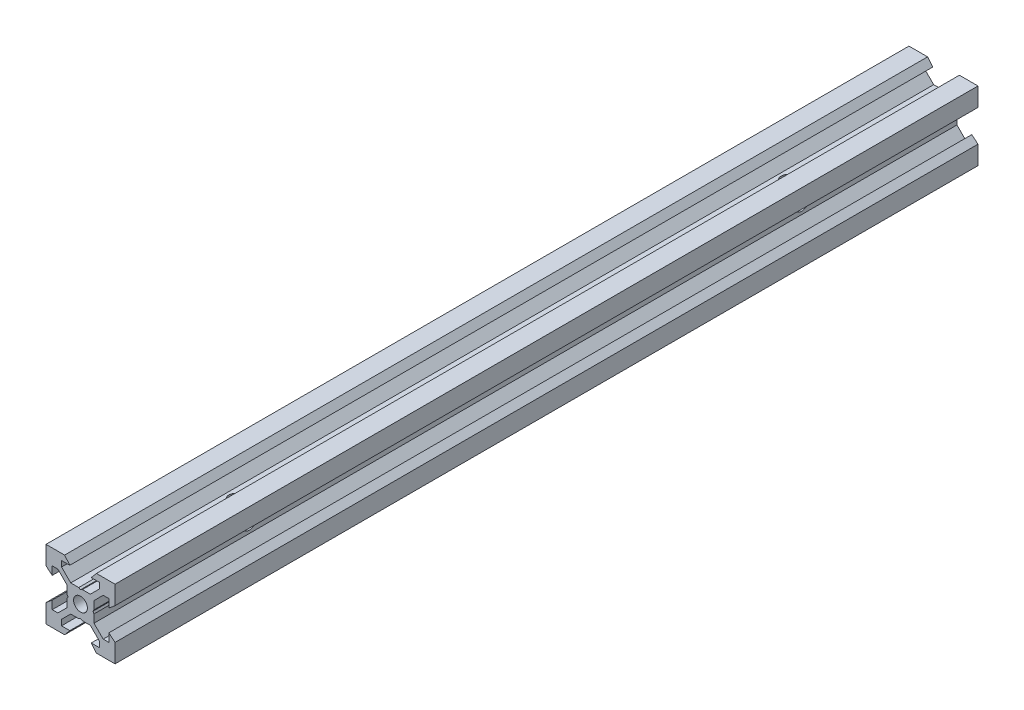
from build123d import *

# Parameters (mm, degrees)
SKETCH1_R               = 2
BOSS_EXTRUDE1_DEPTH     = 250
CUT_EXTRUDE1_DEPTH      = 251.585733832
CUT_EXTRUDE1_DEPTH_BACK = 251.585733832
SKETCH2_R               = 2
CUT_EXTRUDE2_DEPTH      = 251.585733832
CUT_EXTRUDE2_DEPTH_BACK = 251.585733832
SKETCH3_R               = 2


with BuildPart() as part:
    # Sketch1 → Boss-Extrude1 (new body)
    with BuildSketch(Plane.XY):
        Polygon((10, 4.610379336), (10, 10), (4.610379336, 10), (3.1, 8.2), (5.5, 8.2), (5.5, 6.560660172), (2.839339828, 3.9), (0.519615242, 3.9), (0, 3.6), (-0.519615242, 3.9), (-2.839339828, 3.9), (-5.5, 6.560660172), (-5.5, 8.2), (-3.1, 8.2), (-4.610379336, 10), (-10, 10), (-10, 4.610379336), (-8.2, 3.1), (-8.2, 5.5), (-6.560660172, 5.5), (-3.9, 2.839339828), (-3.9, 0.519615242), (-3.6, 0), (-3.9, -0.519615242), (-3.9, -2.839339828), (-6.560660172, -5.5), (-8.2, -5.5), (-8.2, -3.1), (-10, -4.610379336), (-10, -10), (-4.610379336, -10), (-3.1, -8.2), (-5.5, -8.2), (-5.5, -6.560660172), (-2.839339828, -3.9), (-0.519615242, -3.9), (0, -3.6), (0.519615242, -3.9), (2.839339828, -3.9), (5.5, -6.560660172), (5.5, -8.2), (3.1, -8.2), (4.610379336, -10), (10, -10), (10, -4.610379336), (8.2, -3.1), (8.2, -5.5), (6.560660172, -5.5), (3.9, -2.839339828), (3.9, -0.519615242), (3.6, 0), (3.9, 0.519615242), (3.9, 2.839339828), (6.560660172, 5.5), (8.2, 5.5), (8.2, 3.1), align=None)
        Circle(SKETCH1_R, mode=Mode.SUBTRACT)
    extrude(amount=BOSS_EXTRUDE1_DEPTH)

    # Sketch2 → Cut-Extrude1 (cut, two sides: drawn at the far end of the back side and taken through both)
    with BuildSketch(Plane(origin=(0, -3.9, 0), x_dir=(-1, 0, 0), z_dir=(0, -1, 0)).offset(-CUT_EXTRUDE1_DEPTH_BACK)):
        with Locations((0, -205)):
            Circle(SKETCH2_R)
        with Locations((0, -45)):
            Circle(SKETCH2_R)
    extrude(amount=CUT_EXTRUDE1_DEPTH + CUT_EXTRUDE1_DEPTH_BACK, mode=Mode.SUBTRACT)

    # Sketch3 → Cut-Extrude2 (cut, two sides: drawn at the far end of the back side and taken through both)
    with BuildSketch(Plane(origin=(3.9, 0, 0), x_dir=(0, 0, -1), z_dir=(1, 0, 0)).offset(-CUT_EXTRUDE2_DEPTH_BACK)):
        with Locations((-45, 0)):
            Circle(SKETCH3_R)
        with Locations((-205, 0)):
            Circle(SKETCH3_R)
    extrude(amount=CUT_EXTRUDE2_DEPTH + CUT_EXTRUDE2_DEPTH_BACK, mode=Mode.SUBTRACT)


solid = part.part
